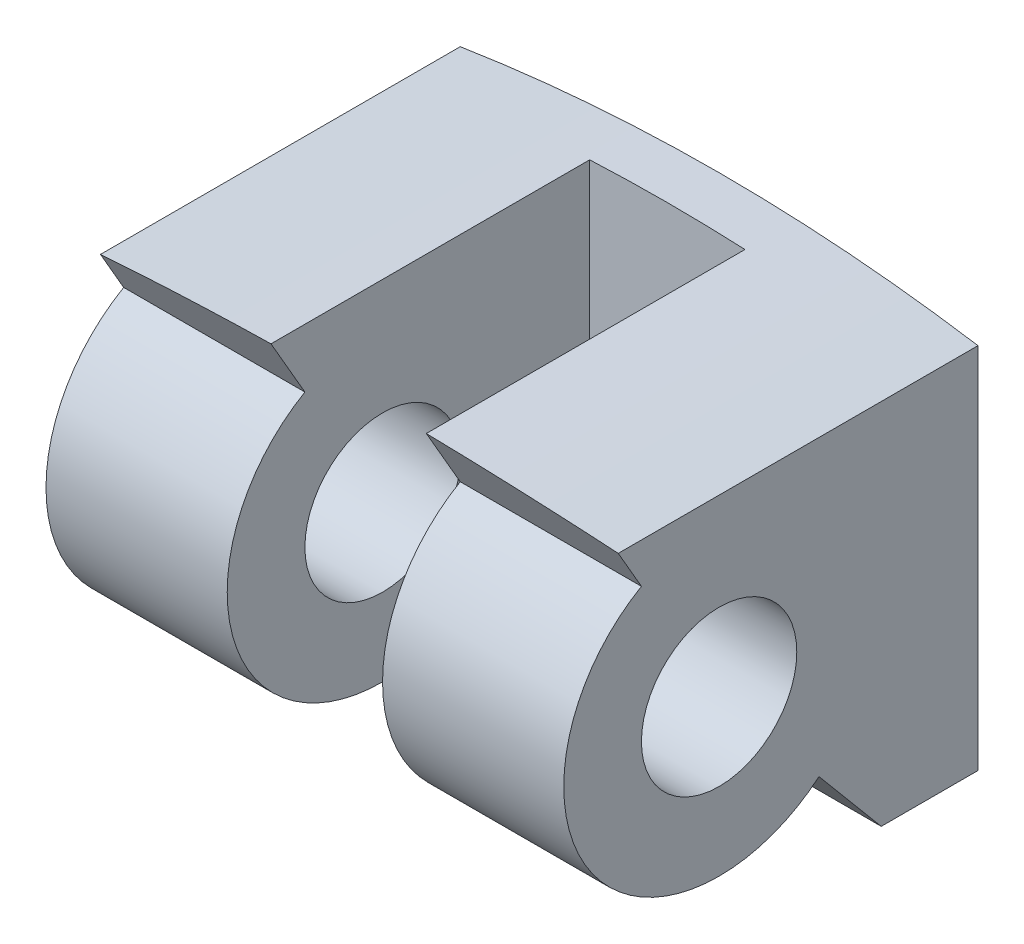
from build123d import *

# Parameters (mm, degrees)
SALIENTE_EXTRUIR1_DEPTH            = 8
CROQUIS2_W                         = 3
CROQUIS2_H                         = 7
CORTAR_EXTRUIR1_DEPTH              = 10
CORTAR_EXTRUIR3_REACH              = 35.619
CROQUIS3_R                         = 1.5
CORTAR_EXTRUIR3_DIRECTION_2_REACH  = 35.619
CROQUIS6_W                         = 10
CROQUIS6_H                         = 7
CORTAR_REVOLUCI_N4_ANGLE           = 130
CORTAR_REVOLUCI_N4_OTHER_WAY_ANGLE = 60


with BuildPart() as part:
    # Croquis1 → Saliente-Extruir1 (new body)
    with BuildSketch(Plane.XY):
        with BuildLine():
            Line((-5, 31.606961259), (-5, 24.5))
            Line((-5, 24.5), (5, 24.5))
            Line((5, 24.5), (5, 31.606961259))
            ThreePointArc((5, 31.606961259), (0, 32), (-5, 31.606961259))
        make_face()
    extrude(amount=SALIENTE_EXTRUIR1_DEPTH)

    # Croquis2 → Cortar-Extruir1 (cut)
    with BuildSketch(Plane.XZ.offset(-24.5)):
        with Locations((0, 4.5)):
            Rectangle(CROQUIS2_W, CROQUIS2_H)
    extrude(amount=-CORTAR_EXTRUIR1_DEPTH, mode=Mode.SUBTRACT)

    # Cortar-Extruir3: up to this face of the body (flat: up to its plane)
    cortar_extruir3_end = Plane(part.part.faces().sort_by_distance((-5, 28.053480629, 4))[0])
    # Croquis3 → Cortar-Extruir3 (cut, up to the picked face)
    with BuildSketch(Plane(origin=(-1.5, 0, 0), x_dir=(0, 0, -1), z_dir=(1, 0, 0)), mode=Mode.PRIVATE) as cortar_extruir3_sk1:
        with Locations((-5, 28.232412208)):
            Circle(CROQUIS3_R)
    cortar_extruir3_tool1 = split(extrude(cortar_extruir3_sk1.sketch, amount=-CORTAR_EXTRUIR3_REACH, mode=Mode.PRIVATE), bisect_by=cortar_extruir3_end, keep=Keep.BOTH, mode=Mode.PRIVATE)
    add(cortar_extruir3_tool1.solids().sort_by(Axis((-1.5, 28.232412, 5), (-1, 0, 0)))[0], mode=Mode.SUBTRACT)

    # Cortar-Extruir3 direction 2: up to this face of the body (flat: up to its plane)
    cortar_extruir3_direction_2_end = Plane(part.part.faces().sort_by_distance((5, 28.053480629, 4))[0])
    # Croquis3 → Cortar-Extruir3 direction 2 (cut, up to the picked face)
    with BuildSketch(Plane(origin=(-1.5, 0, 0), x_dir=(0, 0, -1), z_dir=(1, 0, 0)), mode=Mode.PRIVATE) as cortar_extruir3_direction_2_sk1:
        with Locations((-5, 28.232412208)):
            Circle(CROQUIS3_R)
    cortar_extruir3_direction_2_tool1 = split(extrude(cortar_extruir3_direction_2_sk1.sketch, amount=CORTAR_EXTRUIR3_DIRECTION_2_REACH, mode=Mode.PRIVATE), bisect_by=cortar_extruir3_direction_2_end, keep=Keep.BOTH, mode=Mode.PRIVATE)
    add(cortar_extruir3_direction_2_tool1.solids().sort_by(Axis((-1.5, 28.232412, 5), (1, 0, 0)))[0], mode=Mode.SUBTRACT)

    # Croquis6 → Cortar-Revolución4 (revolve, cut)
    with BuildSketch(Plane(origin=(0, 28.232412208, 0), x_dir=(1, 0, 0), z_dir=(0, 1, 0))):
        with Locations((0, -11.5)):
            Rectangle(CROQUIS6_W, CROQUIS6_H)
    revolve(axis=Axis((1.5, 28.232412208, 5), (1, 0, 0)), revolution_arc=CORTAR_REVOLUCI_N4_ANGLE, mode=Mode.SUBTRACT)

    # Croquis6 → Cortar-Revolución4 other way (revolve, cut)
    with BuildSketch(Plane(origin=(0, 28.232412208, 0), x_dir=(1, 0, 0), z_dir=(0, 1, 0))):
        with Locations((0, -11.5)):
            Rectangle(CROQUIS6_W, CROQUIS6_H)
    revolve(axis=Axis((1.5, 28.232412208, 5), (-1, 0, 0)), revolution_arc=CORTAR_REVOLUCI_N4_OTHER_WAY_ANGLE, mode=Mode.SUBTRACT)


solid = part.part
